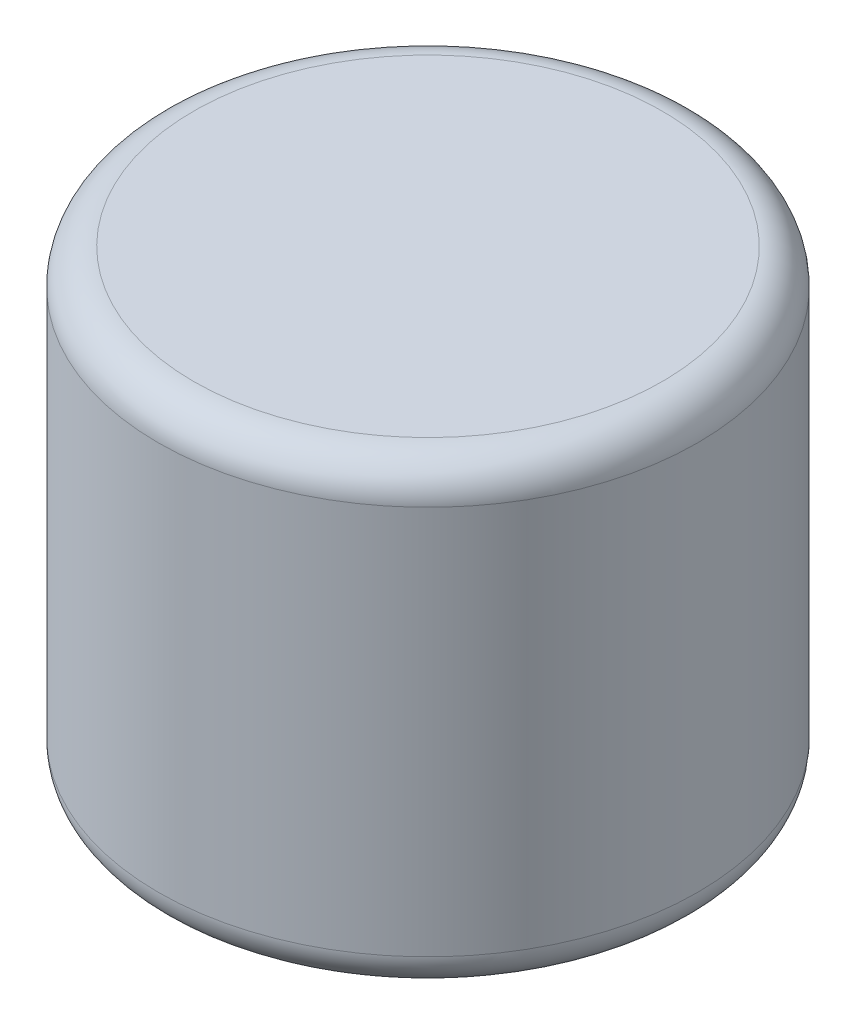
from build123d import *

# Parameters (mm, degrees)
SKETCH1_R           = 76.2
BOSS_EXTRUDE1_DEPTH = 130
FILLET3_R           = 10


with BuildPart() as part:
    # Sketch1 → Boss-Extrude1 (new body)
    with BuildSketch(Plane(origin=(0, 0, 0), x_dir=(1, 0, 0), z_dir=(0, 1, 0))):
        Circle(SKETCH1_R)
    extrude(amount=BOSS_EXTRUDE1_DEPTH)

    # Fillet3
    fillet3_edges = [part.edges().sort_by_distance(p)[0] for p in [
        (-76.2, 0, 0),
        (-76.2, 130, 0),
    ]]
    fillet(fillet3_edges, radius=FILLET3_R)


solid = part.part
